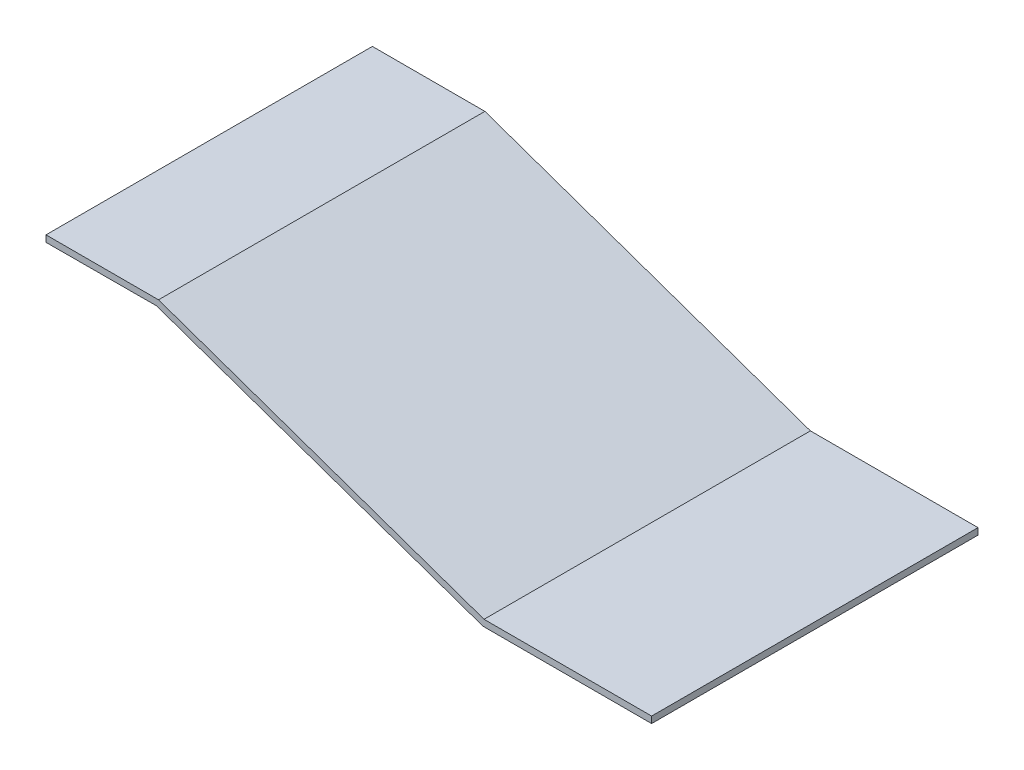
from build123d import *

# Parameters (mm, degrees)
BOSS_EXTRUDE1_DEPTH = 1000


with BuildPart() as part:
    # Sketch1 → Boss-Extrude1 (new body)
    with BuildSketch(Plane.XY):
        Polygon((0, 76.661083739), (0, 56.661083739), (338.719471809, 57.585110825), (1338.719471809, -292.414889175), (1338.719471809, -272.414889175), (1342.088325889, -272.414889175), (344.728403277, 76.661083739), align=None)
        Polygon((1338.719471809, -272.414889175), (1338.719471809, -292.414889175), (1399.231183031, -292.414889175), (1342.088325889, -272.414889175), align=None)
        Polygon((1855.588314329, -272.414889175), (1342.088325889, -272.414889175), (1399.231183031, -292.414889175), (1855.588314329, -292.414889175), align=None)
    extrude(amount=BOSS_EXTRUDE1_DEPTH)


solid = part.part
